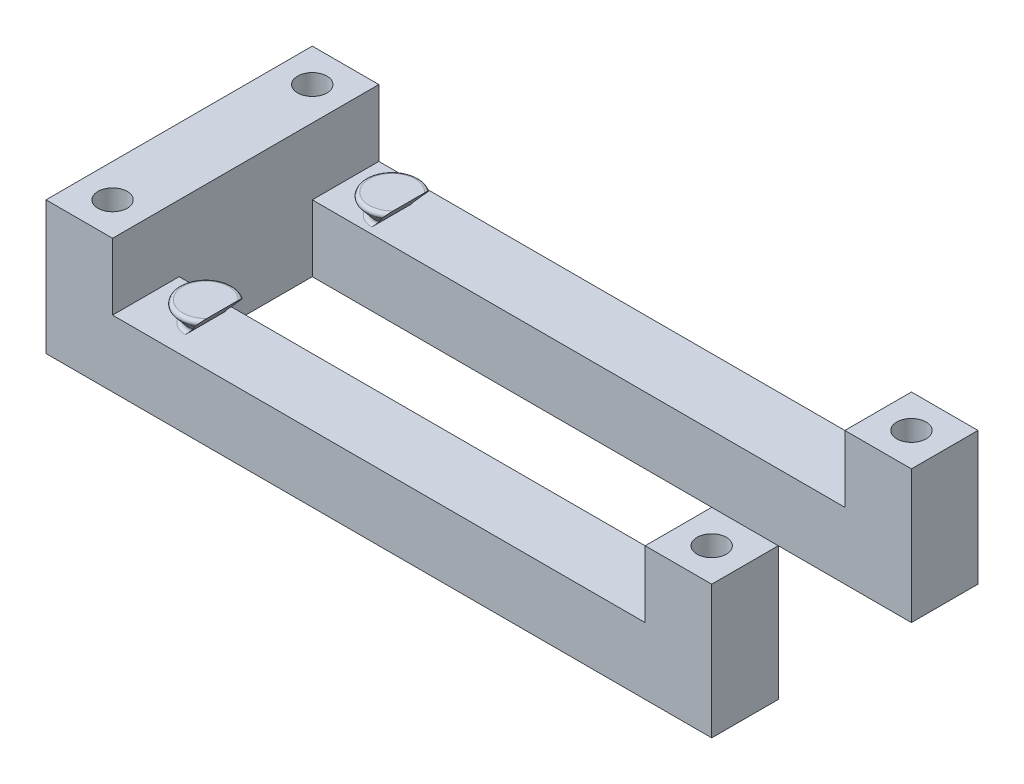
from build123d import *

# Parameters (mm, degrees)
SKETCH1_R             = 2.2
BOSS_EXTRUDE1_DEPTH   = 10
SKETCH5_W             = 10
SKETCH5_H             = 40
SKETCH5_R             = 2.2
SKETCH5_H_2           = 10
BOSS_EXTRUDE3_DEPTH   = 10
SKETCH6_R             = 4.215
CUT_EXTRUDE1_DEPTH    = 2.5
CHAMFER2_SIZE         = 1
BOSS_EXTRUDE4_DEPTH   = 3
BOSS_EXTRUDE4_DRAFT   = -40
BOSS_EXTRUDE4_2_DEPTH = 3
BOSS_EXTRUDE4_2_DRAFT = -40
FILLET1_R             = 0.5


# Read off the part's stored shape, not the designer's step: Boss-Extrude4
with BuildPart() as part:
    # Sketch1 → Boss-Extrude1 (new body)
    with BuildSketch(Plane(origin=(0, 0, 0), x_dir=(1, 0, 0), z_dir=(0, 1, 0))):
        Polygon((10, 10), (10, 30), (90, 30), (100, 30), (100, 40), (0, 40), (0, 0), (100, 0), (100, 10), (90, 10), align=None)
        with Locations(Location((5, 5, 0), (0, 0, 270))):
            Circle(SKETCH1_R, mode=Mode.SUBTRACT)
        with Locations(Location((95, 5, 0), (0, 0, 270))):
            Circle(SKETCH1_R, mode=Mode.SUBTRACT)
        with Locations(Location((5, 35, 0), (0, 0, 270))):
            Circle(SKETCH1_R, mode=Mode.SUBTRACT)
        with Locations(Location((95, 35, 0), (0, 0, 270))):
            Circle(SKETCH1_R, mode=Mode.SUBTRACT)
    extrude(amount=BOSS_EXTRUDE1_DEPTH)

    # Sketch5 → Boss-Extrude3 (add)
    # profile 1 of 3: a face of its own
    with BuildSketch(Plane(origin=(0, 10, 0), x_dir=(1, 0, 0), z_dir=(0, 1, 0))):
        with Locations((5, 20)):
            Rectangle(SKETCH5_W, SKETCH5_H)
        with Locations(Location((5, 5, 0), (0, 0, 270))):
            Circle(SKETCH5_R, mode=Mode.SUBTRACT)
        with Locations(Location((5, 35, 0), (0, 0, 270))):
            Circle(SKETCH5_R, mode=Mode.SUBTRACT)
    # profile 2 of 3: a face of its own
    with BuildSketch(Plane(origin=(0, 10, 0), x_dir=(1, 0, 0), z_dir=(0, 1, 0))):
        with Locations((95, 5)):
            Rectangle(SKETCH5_W, SKETCH5_H_2)
        with Locations(Location((95, 5, 0), (0, 0, 270))):
            Circle(SKETCH5_R, mode=Mode.SUBTRACT)
    # profile 3 of 3: a face of its own
    with BuildSketch(Plane(origin=(0, 10, 0), x_dir=(1, 0, 0), z_dir=(0, 1, 0))):
        with Locations((95, 35)):
            Rectangle(SKETCH5_W, SKETCH5_H_2)
        with Locations(Location((95, 35, 0), (0, 0, 270))):
            Circle(SKETCH5_R, mode=Mode.SUBTRACT)
    extrude(amount=BOSS_EXTRUDE3_DEPTH)

    # Sketch6 → Cut-Extrude1 (cut)
    with BuildSketch(Plane.XZ):
        with Locations(Location((5, -35, 0), (0, 0, 270))):
            Circle(SKETCH6_R)
        with Locations(Location((5, -5, 0), (0, 0, 270))):
            Circle(SKETCH6_R)
        with Locations(Location((95, -5, 0), (0, 0, 270))):
            Circle(SKETCH6_R)
        with Locations(Location((95, -35, 0), (0, 0, 270))):
            Circle(SKETCH6_R)
    extrude(amount=-CUT_EXTRUDE1_DEPTH, mode=Mode.SUBTRACT)

    # Chamfer2
    chamfer2_edges = [part.edges().sort_by_distance(p)[0] for p in [
        (95, 2.5, -30.785),
        (95, 2.5, -0.785),
        (5, 2.5, -0.785),
        (5, 2.5, -30.785),
    ]]
    chamfer(chamfer2_edges, length=CHAMFER2_SIZE)


with BuildPart() as boss_extrude4_tool:
    # Boss-Extrude4 outline → Boss-Extrude4 (with draft: the straight prism first)
    with BuildSketch(Plane(origin=(0, 13, 0), x_dir=(1, 0, 0), z_dir=(0, 1, 0))):
        with BuildLine():
            ThreePointArc((20.517298894, 9.750892637), (13.482701106, 6), (20.517298894, 2.249107363))
            Line((20.517298894, 2.249107363), (20.517298894, 9.750892637))
        make_face()
    extrude(amount=-BOSS_EXTRUDE4_DEPTH)
    # Boss-Extrude4: the draft: its side faces are tilted about the plane it starts from
    boss_extrude4_sides = [boss_extrude4_tool.faces().sort_by_distance(p)[0] for p in [
        (20.517298894, 11.5, -6),
        (13.482701106, 11.5, -6),
    ]]
    draft(boss_extrude4_sides, Plane(origin=(0, 13, 0), x_dir=(1, 0, 0), z_dir=(0, 1, 0)), BOSS_EXTRUDE4_DRAFT)


with BuildPart() as part_1:
    add(part.part)

    # Boss-Extrude4: add boss_extrude4_tool
    add(boss_extrude4_tool.part)


with BuildPart() as boss_extrude4_2_tool:
    # Boss-Extrude4 2 outline → Boss-Extrude4 2 (with draft: the straight prism first)
    with BuildSketch(Plane(origin=(0, 13, 0), x_dir=(1, 0, 0), z_dir=(0, 1, 0))):
        with BuildLine():
            ThreePointArc((20.517298894, 37.750892637), (13.482701106, 34), (20.517298894, 30.249107363))
            Line((20.517298894, 30.249107363), (20.517298894, 37.750892637))
        make_face()
    extrude(amount=-BOSS_EXTRUDE4_2_DEPTH)
    # Boss-Extrude4 2: the draft: its side faces are tilted about the plane it starts from
    boss_extrude4_2_sides = [boss_extrude4_2_tool.faces().sort_by_distance(p)[0] for p in [
        (13.482701106, 11.5, -34),
        (20.517298894, 11.5, -34),
    ]]
    draft(boss_extrude4_2_sides, Plane(origin=(0, 13, 0), x_dir=(1, 0, 0), z_dir=(0, 1, 0)), BOSS_EXTRUDE4_2_DRAFT)


with BuildPart() as part_2:
    add(part_1.part)

    # Boss-Extrude4 2: add boss_extrude4_2_tool
    add(boss_extrude4_2_tool.part)

    # Fillet1
    fillet1_edges = [part_2.edges().sort_by_distance(p)[0] for p in [
        (13.482701106, 13, -34),
        (16, 10, -34),
        (13.482701106, 13, -6),
        (16, 10, -6),
    ]]
    fillet(fillet1_edges, radius=FILLET1_R)


solid = part_2.part
